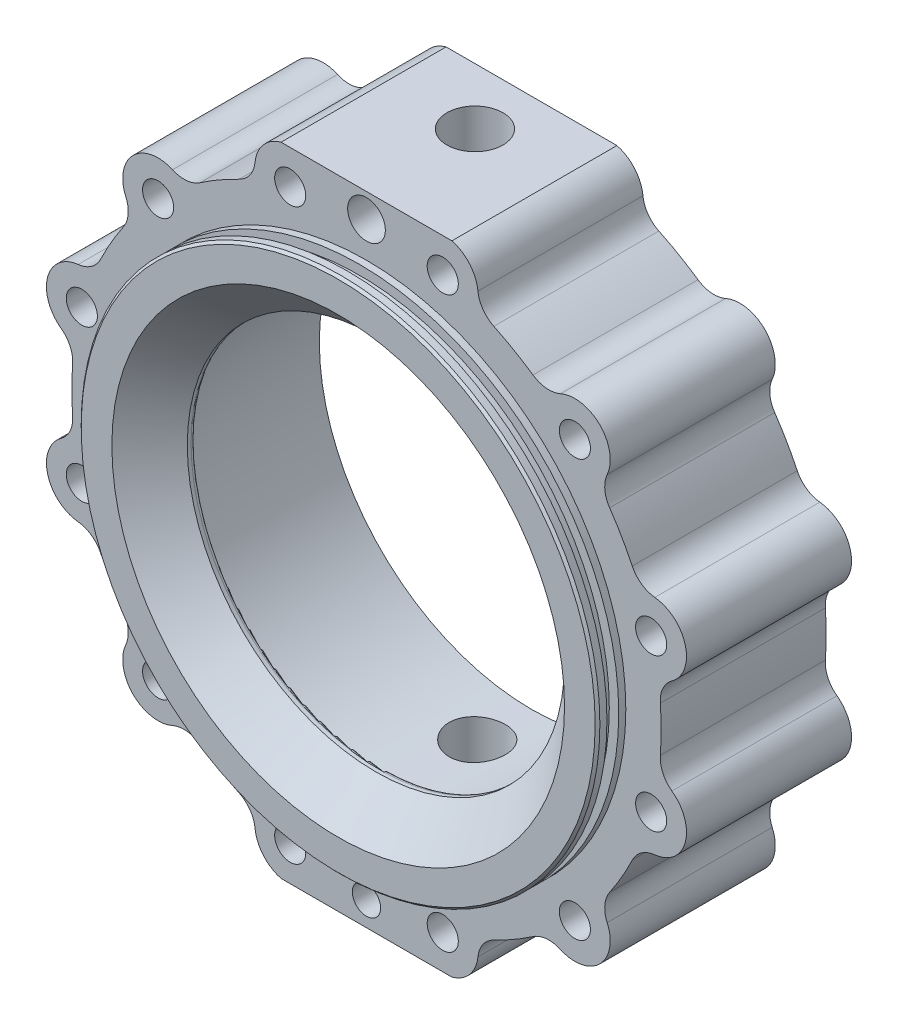
from build123d import *

# Parameters (mm, degrees)
SKETCH2_R                        = 3
CUT_EXTRUDE1_DEPTH               = 9
SKETCH3_R                        = 4
CUT_EXTRUDE2_DEPTH               = 10
SKETCH9_W                        = 2
SKETCH9_H                        = 2.5
CHAMFER1_SIZE                    = 0.5
M6_CLEARANCE_HOLE1_D             = 6.6
FILLET2_R                        = 1
CHAMFER2_SIZE                    = 8
LOOKSMAXXING_DEPTH               = 108.14942837
F_1_4_18_NPSM_TAPPED_HOLE1_D     = 11.8872
F_1_4_18_NPSM_TAPPED_HOLE1_DEPTH = 30.96
F_1_4_18_NPSM_TAPPED_HOLE1_TIP   = 3.571275175
F_1_4_18_NPSM_TAPPED_HOLE2_D     = 11.8872
F_1_4_18_NPSM_TAPPED_HOLE2_DEPTH = 30.96
F_1_4_18_NPSM_TAPPED_HOLE2_TIP   = 3.571275175


with BuildPart() as part:
    # Sketch1 → Revolve1 (revolve)
    with BuildSketch(Plane(origin=(0, 0, 0), x_dir=(1, 0, 0), z_dir=(0, 1, 0))):
        Polygon((-55, -15.79575879), (-55, -9.79575879), (-70, -9.79575879), (-70, 25.20424121), (-45, 25.20424121), (-45, -6), (-40, -6), (-40, -15.79575879), align=None)
    revolve(axis=Axis((0, 0, -52.707374268), (0, 0, 1)))

    # Sketch2 → Cut-Extrude1 (cut)
    with BuildSketch(Plane.XY.offset(9.79575879)):
        with Locations((0, -62.5)):
            Circle(SKETCH2_R)
    extrude(amount=-CUT_EXTRUDE1_DEPTH, mode=Mode.SUBTRACT)

    # Sketch3 → Cut-Extrude2 (cut)
    with BuildSketch(Plane.XY.offset(9.79575879)):
        with Locations((0, 62.5)):
            Circle(SKETCH3_R)
    extrude(amount=-CUT_EXTRUDE2_DEPTH, mode=Mode.SUBTRACT)

    # Sketch9 → Oring groove (revolve, cut)
    with BuildSketch(Plane(origin=(0, 0, 0), x_dir=(1, 0, 0), z_dir=(0, 1, 0))):
        with Locations((-54, -12.54575879)):
            Rectangle(SKETCH9_W, SKETCH9_H)
    revolve(axis=Axis((0, 0, -11.30771881), (0, 0, 1)), mode=Mode.SUBTRACT)

    # Chamfer1
    chamfer1_edges = [part.edges().sort_by_distance(p)[0] for p in [
        (55, 0, 15.79575879),
    ]]
    chamfer(chamfer1_edges, length=CHAMFER1_SIZE)

    # M6 Clearance Hole1 (through all)
    with Locations(Plane.XY.offset(9.79575879)):
        with Locations((-60.370364143, 16.176190319), (-44.194173824, 44.194173824), (-16.176190319, 60.370364143), (16.176190319, 60.370364143), (44.194173824, 44.194173824), (60.370364143, 16.176190319), (60.370364143, -16.176190319), (44.194173824, -44.194173824), (16.176190319, -60.370364143), (-16.176190319, -60.370364143), (-44.194173824, -44.194173824), (-60.370364143, -16.176190319), (0, 0)):
            Hole(M6_CLEARANCE_HOLE1_D / 2)

    # Fillet2
    fillet2_edges = [part.edges().sort_by_distance(p)[0] for p in [
        (40, 0, 6),
    ]]
    fillet(fillet2_edges, radius=FILLET2_R)

    # Chamfer2
    chamfer2_edges = [part.edges().sort_by_distance(p)[0] for p in [
        (40, 0, 15.79575879),
    ]]
    chamfer(chamfer2_edges, length=CHAMFER2_SIZE)

    # Sketch11 → looksmaxxing (cut, through all)
    with BuildSketch(Plane(origin=(0, 0, -25.20424121), x_dir=(-1, 0, 0), z_dir=(0, 0, -1))):
        with BuildLine():
            ThreePointArc((18.117333157, 67.61480784), (0, 70), (-18.117333157, 67.61480784))
            Line((-18.117333157, 67.61480784), (18.117333157, 67.61480784))
        make_face()
        with BuildLine():
            ThreePointArc((-23.635598574, 61.149612809), (-21.88077417, 65.239421864), (-18.117333157, 67.61480784))
            ThreePointArc((-18.117333157, 67.61480784), (-35.000000007, 60.621778261), (-49.497474694, 49.497474672))
            ThreePointArc((-49.497474694, 49.497474672), (-45.558609585, 51.569017216), (-41.139318837, 51.043835203))
            ThreePointArc((-41.139318837, 51.043835203), (-38.153781824, 50.548063323), (-35.306053693, 51.57259517))
            ThreePointArc((-35.306053693, 51.57259517), (-31.25, 54.126587737), (-27.01015071, 56.362236991))
            ThreePointArc((-27.01015071, 56.362236991), (-24.699016038, 58.316175972), (-23.635598574, 61.149612809))
        make_face()
        with BuildLine():
            ThreePointArc((49.497474665, 49.497474701), (34.999999989, 60.621778271), (18.117333157, 67.61480784))
            ThreePointArc((18.117333157, 67.61480784), (21.88077417, 65.239421864), (23.635598574, 61.149612809))
            ThreePointArc((23.635598574, 61.149612809), (24.699016038, 58.316175972), (27.01015071, 56.362236991))
            ThreePointArc((27.01015071, 56.362236991), (31.25, 54.126587737), (35.306053693, 51.57259517))
            ThreePointArc((35.306053693, 51.57259517), (38.153781824, 50.548063323), (41.139318837, 51.043835203))
            ThreePointArc((41.139318837, 51.043835203), (45.558609565, 51.56901722), (49.497474665, 49.497474701))
        make_face()
        with BuildLine():
            ThreePointArc((-51.043835203, 41.139318837), (-51.569017219, 45.55860957), (-49.497474694, 49.497474672))
            ThreePointArc((-49.497474694, 49.497474672), (-60.62177824, 35.000000042), (-67.614807811, 18.117333266))
            ThreePointArc((-67.614807811, 18.117333266), (-65.239421821, 21.880774206), (-61.149612809, 23.635598574))
            ThreePointArc((-61.149612809, 23.635598574), (-58.316175972, 24.699016038), (-56.362236991, 27.01015071))
            ThreePointArc((-56.362236991, 27.01015071), (-54.126587737, 31.25), (-51.57259517, 35.306053693))
            ThreePointArc((-51.57259517, 35.306053693), (-50.548063323, 38.153781824), (-51.043835203, 41.139318837))
        make_face()
        with BuildLine():
            ThreePointArc((67.614807872, 18.117333038), (60.621778289, 34.999999958), (49.497474665, 49.497474701))
            ThreePointArc((49.497474665, 49.497474701), (51.569017215, 45.55860959), (51.043835203, 41.139318837))
            ThreePointArc((51.043835203, 41.139318837), (50.548063323, 38.153781824), (51.57259517, 35.306053693))
            ThreePointArc((51.57259517, 35.306053693), (54.126587737, 31.25), (56.362236991, 27.01015071))
            ThreePointArc((56.362236991, 27.01015071), (58.316175972, 24.699016038), (61.149612809, 23.635598574))
            ThreePointArc((61.149612809, 23.635598574), (65.239421911, 21.88077413), (67.614807872, 18.117333038))
        make_face()
        with BuildLine():
            ThreePointArc((-64.774917411, 10.105777606), (-67.439383766, 13.6704047), (-67.614807811, 18.117333266))
            ThreePointArc((-67.614807811, 18.117333266), (-70, 5.2e-08), (-67.614807838, -18.117333166))
            ThreePointArc((-67.614807838, -18.117333166), (-67.439383749, -13.670404651), (-64.774917411, -10.105777606))
            ThreePointArc((-64.774917411, -10.105777606), (-62.852797862, -7.768112649), (-62.316204403, -4.789641821))
            ThreePointArc((-62.316204403, -4.789641821), (-62.5, 0), (-62.316204403, 4.789641821))
            ThreePointArc((-62.316204403, 4.789641821), (-62.852797862, 7.768112649), (-64.774917411, 10.105777606))
        make_face()
        with BuildLine():
            ThreePointArc((67.614807506, -18.117334404), (70, -7.07e-07), (67.614807872, 18.117333038))
            ThreePointArc((67.614807872, 18.117333038), (67.439383727, 13.670404588), (64.774917411, 10.105777606))
            ThreePointArc((64.774917411, 10.105777606), (62.852797862, 7.768112649), (62.316204403, 4.789641821))
            ThreePointArc((62.316204403, 4.789641821), (62.5, 0), (62.316204403, -4.789641821))
            ThreePointArc((62.316204403, -4.789641821), (62.852797862, -7.768112649), (64.774917411, -10.105777606))
            ThreePointArc((64.774917411, -10.105777606), (67.439383963, -13.670405254), (67.614807506, -18.117334404))
        make_face()
        with BuildLine():
            ThreePointArc((-61.149612809, -23.635598574), (-65.23942186, -21.880774173), (-67.614807838, -18.117333166))
            ThreePointArc((-67.614807838, -18.117333166), (-60.621778257, -35.000000014), (-49.497474667, -49.497474699))
            ThreePointArc((-49.497474667, -49.497474699), (-51.569017215, -45.558609589), (-51.043835203, -41.139318837))
            ThreePointArc((-51.043835203, -41.139318837), (-50.548063323, -38.153781824), (-51.57259517, -35.306053693))
            ThreePointArc((-51.57259517, -35.306053693), (-54.126587737, -31.25), (-56.362236991, -27.01015071))
            ThreePointArc((-56.362236991, -27.01015071), (-58.316175972, -24.699016038), (-61.149612809, -23.635598574))
        make_face()
        with BuildLine():
            ThreePointArc((-41.139318837, -51.043835203), (-45.558609566, -51.56901722), (-49.497474667, -49.497474699))
            ThreePointArc((-49.497474667, -49.497474699), (-34.99999999, -60.621778271), (-18.117333157, -67.61480784))
            ThreePointArc((-18.117333157, -67.61480784), (-21.88077417, -65.239421864), (-23.635598574, -61.149612809))
            ThreePointArc((-23.635598574, -61.149612809), (-24.699016038, -58.316175972), (-27.01015071, -56.362236991))
            ThreePointArc((-27.01015071, -56.362236991), (-31.25, -54.126587737), (-35.306053693, -51.57259517))
            ThreePointArc((-35.306053693, -51.57259517), (-38.153781824, -50.548063323), (-41.139318837, -51.043835203))
        make_face()
        with BuildLine():
            ThreePointArc((49.497474714, -49.497474652), (60.621777953, -35.00000054), (67.614807506, -18.117334404))
            ThreePointArc((67.614807506, -18.117334404), (65.239421373, -21.880774589), (61.149612809, -23.635598574))
            ThreePointArc((61.149612809, -23.635598574), (58.316175972, -24.699016038), (56.362236991, -27.01015071))
            ThreePointArc((56.362236991, -27.01015071), (54.126587737, -31.25), (51.57259517, -35.306053693))
            ThreePointArc((51.57259517, -35.306053693), (50.548063323, -38.153781824), (51.043835203, -41.139318837))
            ThreePointArc((51.043835203, -41.139318837), (51.569017221, -45.558609556), (49.497474714, -49.497474652))
        make_face()
        with BuildLine():
            Line((18.117333157, -67.61480784), (-18.117333157, -67.61480784))
            ThreePointArc((-18.117333157, -67.61480784), (0, -70), (18.117333157, -67.61480784))
        make_face()
        with BuildLine():
            ThreePointArc((18.117333157, -67.61480784), (35.000000019, -60.621778254), (49.497474714, -49.497474652))
            ThreePointArc((49.497474714, -49.497474652), (45.558609599, -51.569017213), (41.139318837, -51.043835203))
            ThreePointArc((41.139318837, -51.043835203), (38.153781824, -50.548063323), (35.306053693, -51.57259517))
            ThreePointArc((35.306053693, -51.57259517), (31.25, -54.126587737), (27.01015071, -56.362236991))
            ThreePointArc((27.01015071, -56.362236991), (24.699016038, -58.316175972), (23.635598574, -61.149612809))
            ThreePointArc((23.635598574, -61.149612809), (21.88077417, -65.239421864), (18.117333157, -67.61480784))
        make_face()
    extrude(amount=-LOOKSMAXXING_DEPTH, mode=Mode.SUBTRACT)

    # 1/4-18 NPSM Tapped Hole1
    with Locations(Plane(origin=(0, 67.61480784, 0), x_dir=(1, 0, 0), z_dir=(0, 1, 0))):
        with Locations((0, 13.20424121)):
            Hole(F_1_4_18_NPSM_TAPPED_HOLE1_D / 2, depth=F_1_4_18_NPSM_TAPPED_HOLE1_DEPTH)
            with Locations((0, 0, -(F_1_4_18_NPSM_TAPPED_HOLE1_DEPTH + F_1_4_18_NPSM_TAPPED_HOLE1_TIP / 2))):  # 118° drill point
                Cone(0, F_1_4_18_NPSM_TAPPED_HOLE1_D / 2, F_1_4_18_NPSM_TAPPED_HOLE1_TIP, mode=Mode.SUBTRACT)

    # 1/4-18 NPSM Tapped Hole2
    with Locations(Plane.XZ.offset(67.61480784)):
        with Locations((0, -13.70424121)):
            Hole(F_1_4_18_NPSM_TAPPED_HOLE2_D / 2, depth=F_1_4_18_NPSM_TAPPED_HOLE2_DEPTH)
            with Locations((0, 0, -(F_1_4_18_NPSM_TAPPED_HOLE2_DEPTH + F_1_4_18_NPSM_TAPPED_HOLE2_TIP / 2))):  # 118° drill point
                Cone(0, F_1_4_18_NPSM_TAPPED_HOLE2_D / 2, F_1_4_18_NPSM_TAPPED_HOLE2_TIP, mode=Mode.SUBTRACT)


solid = part.part
